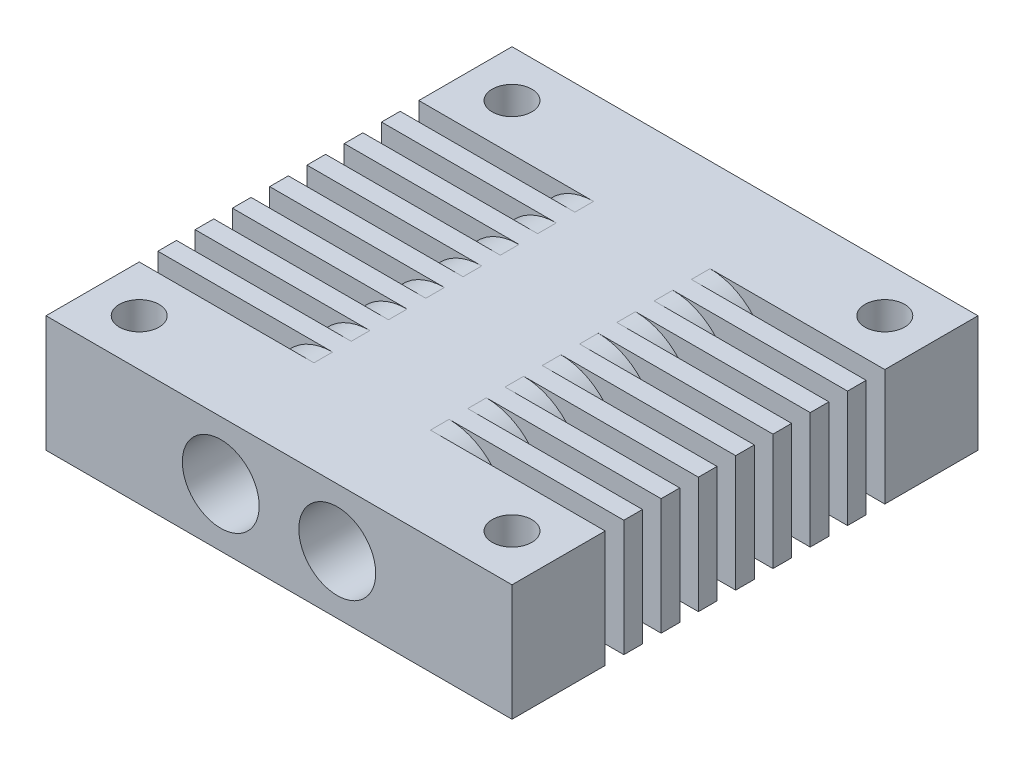
from build123d import *

# Parameters (mm, degrees)
ESQUISSE2_W                       = 40
ESQUISSE2_H                       = 10
BOSS_EXTRU_1_DEPTH                = 40
DIAM_TRE_DU_PER_AGE_4_1_4_1_1_D   = 4.1
DIAM_TRE_DU_PER_AGE_6_0_6_1_D     = 6.1
DIAM_TRE_DU_PER_AGE_6_0_6_1_DEPTH = 20
D_GAGEMENT_M31_D                  = 3.4
R_P_TITION_LIN_AIRE2_COUNT        = 2
R_P_TITION_LIN_AIRE2_PITCH        = 10
ENL_V_START                       = 8
ESQUISSE20_R                      = 30.056093749
ENL_V_MAT_EXTRU_1_DEPTH           = 1.6
R_P_TITION_LIN_AIRE1_COUNT        = 8
R_P_TITION_LIN_AIRE1_PITCH        = 3.2


with BuildPart() as part:
    # Esquisse2 → Boss.-Extru.1 (new body)
    with BuildSketch(Plane.XY):
        with Locations((20, 5)):
            Rectangle(ESQUISSE2_W, ESQUISSE2_H)
    extrude(amount=BOSS_EXTRU_1_DEPTH)

    # Diamètre du perçage Ø4.1 (4.1)1 (through all)
    with Locations(Plane.XY.offset(40)):
        with Locations((25, 5)):
            diam_tre_du_per_age_4_1_4_1_1 = Hole(DIAM_TRE_DU_PER_AGE_4_1_4_1_1_D / 2)

    # Esquisse9 → Dégagement M61 (revolve, cut)
    with BuildSketch(Plane(origin=(25, 5, 40), x_dir=(0, -1, 0), z_dir=(1, 0, 0))):
        Polygon((0, 0), (0, 9.982840043), (3.3, 8), (3.3, 0), align=None)
    d_gagement_m61 = revolve(axis=Axis((25, 5, 46.35), (0, 0, -1)), mode=Mode.SUBTRACT)

    # Diamètre du perçage Ø6.0 (6)1
    with Locations(Plane(origin=(0, 0, 0), x_dir=(-1, 0, 0), z_dir=(0, 0, -1))):
        with Locations((-25, 5)):
            diam_tre_du_per_age_6_0_6_1 = Hole(DIAM_TRE_DU_PER_AGE_6_0_6_1_D / 2, depth=DIAM_TRE_DU_PER_AGE_6_0_6_1_DEPTH)

    # Dégagement M31 (through all)
    with Locations(Plane(origin=(0, 0, 0), x_dir=(-1, 0, 0), z_dir=(0, -1, 0))):
        with Locations((-4, -36), (-36, -36), (-36, -4), (-4, -4)):
            Hole(D_GAGEMENT_M31_D / 2)

    # Esquisse18 → Dégagement M32 (revolve, cut)
    with BuildSketch(Plane(origin=(25, 0, 4), x_dir=(0, 0, -1), z_dir=(1, 0, 0))):
        Polygon((0, 0), (0, 6.021463052), (1.7, 5), (1.7, 0), align=None)
    d_gagement_m32 = revolve(axis=Axis((25, -6.35, 4), (0, 1, 0)), mode=Mode.SUBTRACT)

    # Répétition linéaire2: Diamètre du perçage Ø4.1 (4.1)1, Dégagement M61, Diamètre du perçage Ø6.0 (6)1, Dégagement M32 ×2
    with Locations(*[(-i * R_P_TITION_LIN_AIRE2_PITCH, 0, 0) for i in range(1, R_P_TITION_LIN_AIRE2_COUNT)]):
        add(diam_tre_du_per_age_4_1_4_1_1, mode=Mode.SUBTRACT)
        add(d_gagement_m61, mode=Mode.SUBTRACT)
        add(diam_tre_du_per_age_6_0_6_1, mode=Mode.SUBTRACT)
        add(d_gagement_m32, mode=Mode.SUBTRACT)

    # Esquisse20 → Enlèv. mat.-Extru.1 (cut)
    with BuildSketch(Plane(origin=(0, 40, 40), x_dir=(-1, 0, 0), z_dir=(0, 0, -1)).offset(ENL_V_START)):
        with Locations((-20, -35)):
            Circle(ESQUISSE20_R)
        with BuildLine():
            Line((-15, -40), (-25, -40))
            ThreePointArc((-25, -40), (-30, -35), (-25, -30))
            Line((-25, -30), (-15, -30))
            ThreePointArc((-15, -30), (-10, -35), (-15, -40))
        make_face(mode=Mode.SUBTRACT)
    enl_v_mat_extru_1 = extrude(amount=ENL_V_MAT_EXTRU_1_DEPTH, mode=Mode.SUBTRACT)

    # Répétition linéaire1: Enlèv. mat.-Extru.1 ×8
    with Locations(*[(0, 0, -i * R_P_TITION_LIN_AIRE1_PITCH) for i in range(1, R_P_TITION_LIN_AIRE1_COUNT)]):
        add(enl_v_mat_extru_1, mode=Mode.SUBTRACT)


solid = part.part
